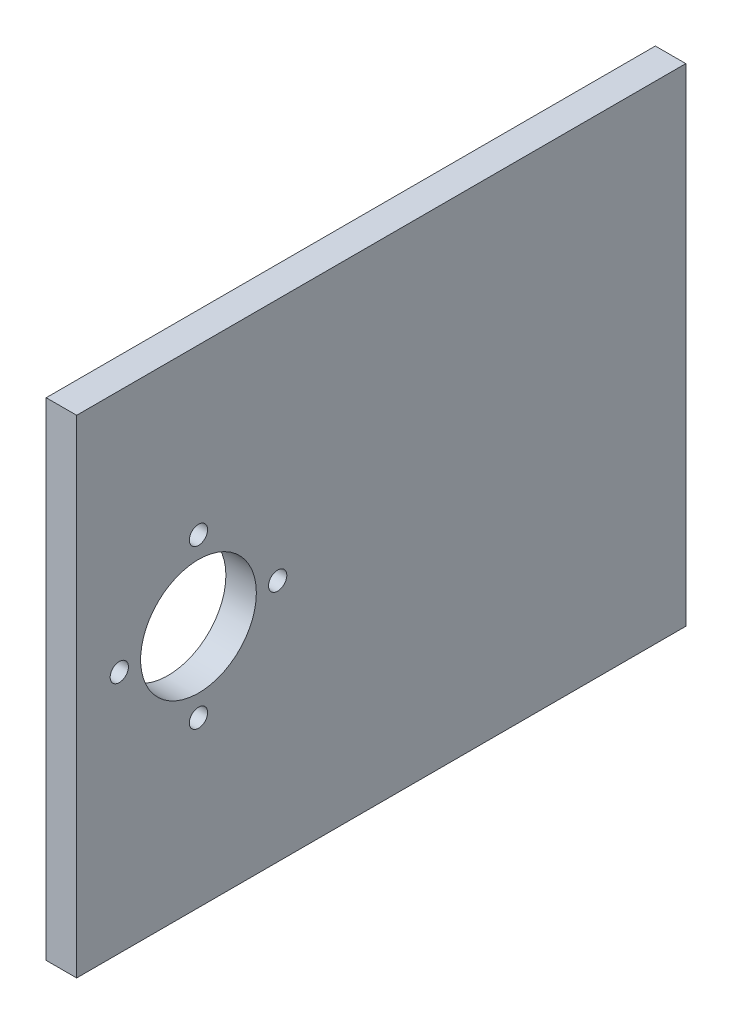
from build123d import *

# Parameters (mm, degrees)
SKETCH1_W           = 80
SKETCH1_H           = 100
SKETCH1_R           = 1.5
SKETCH1_R_2         = 9.5
BOSS_EXTRUDE1_DEPTH = 5


with BuildPart() as part:
    # Sketch1 → Boss-Extrude1 (new body)
    with BuildSketch(Plane.YZ):
        Rectangle(SKETCH1_W, SKETCH1_H)
        with Locations((0, 43)):
            Circle(SKETCH1_R, mode=Mode.SUBTRACT)
        with Locations((0, 17)):
            Circle(SKETCH1_R, mode=Mode.SUBTRACT)
        with Locations((-13, 30)):
            Circle(SKETCH1_R, mode=Mode.SUBTRACT)
        with Locations((13, 30)):
            Circle(SKETCH1_R, mode=Mode.SUBTRACT)
        with Locations((0, 30)):
            Circle(SKETCH1_R_2, mode=Mode.SUBTRACT)
    extrude(amount=BOSS_EXTRUDE1_DEPTH)


solid = part.part
